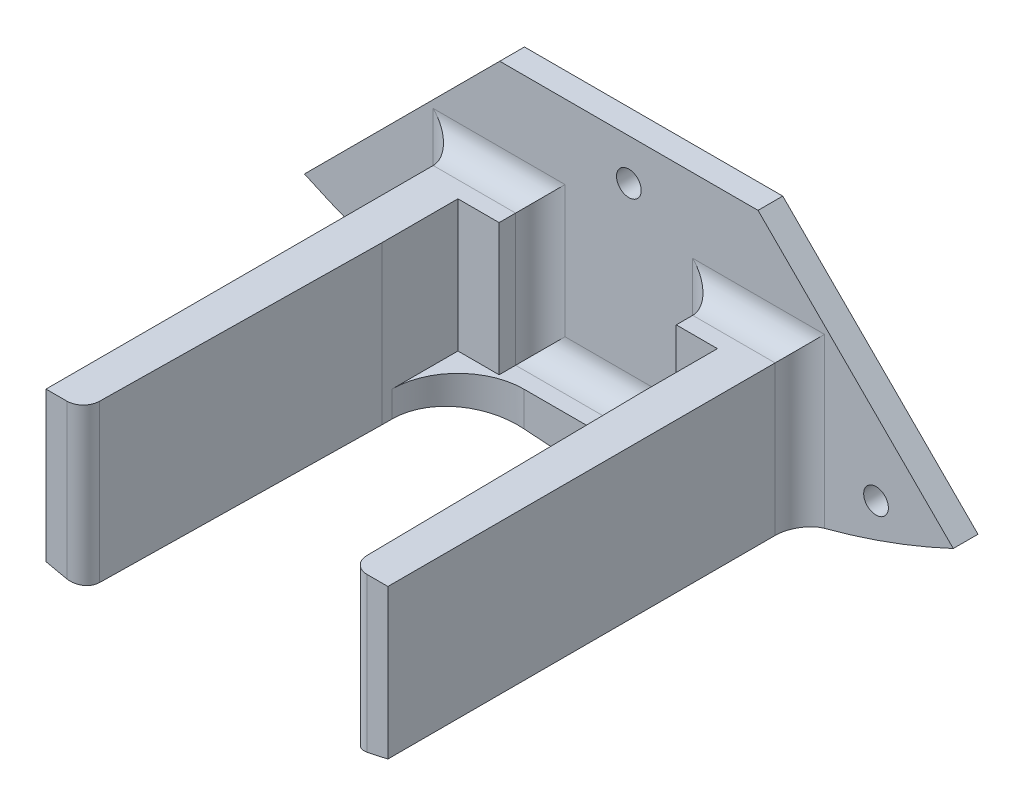
from build123d import *
from OCP.BRepFilletAPI import BRepFilletAPI_MakeChamfer

# Parameters (mm, degrees)
CROQUIS1_R                   = 1.5
SALIENTE_EXTRUIR1_DEPTH      = 3
SALIENTE_EXTRUIR2_DEPTH      = 5
SALIENTE_EXTRUIR3_REACH      = 50.975
SALIENTE_EXTRUIR3_END_RADIUS = 92.5
CROQUIS5_W                   = 5
CROQUIS5_H                   = 50
SALIENTE_EXTRUIR4_DEPTH      = 16
CHAFL_N1_SIZE                = 0.5
CHAFL_N1_SIZE2               = 35.80753506
REDONDEO1_R                  = 2
REDONDEO2_R                  = 3


with BuildPart() as part:
    # Croquis1 → Saliente-Extruir1 (new body)
    with BuildSketch(Plane.XY):
        with BuildLine():
            Line((15.676377407, -60), (-15.676377407, -60))
            Line((-15.676377407, -60), (-39.376624823, -83.700247416))
            ThreePointArc((-39.376624823, -83.700247416), (0, -92.5), (39.376624823, -83.700247416))
            Line((39.376624823, -83.700247416), (15.676377407, -60))
        make_face()
        with Locations((-30, -83.372525695)):
            Circle(CROQUIS1_R, mode=Mode.SUBTRACT)
        with Locations((30, -83.372525695)):
            Circle(CROQUIS1_R, mode=Mode.SUBTRACT)
        with Locations((0, -65)):
            Circle(CROQUIS1_R, mode=Mode.SUBTRACT)
    extrude(amount=SALIENTE_EXTRUIR1_DEPTH)

    # Croquis2 → Saliente-Extruir2 (add)
    with BuildSketch(Plane.XY.offset(3)):
        Polygon((-15.75, -80), (-15.75, -72), (-10.75, -72), (-10.75, -88), (-15.75, -88), align=None)
        Polygon((15.75, -80), (15.75, -88), (10.75, -88), (10.75, -72), (15.75, -72), align=None)
    extrude(amount=SALIENTE_EXTRUIR2_DEPTH)

    # Saliente-Extruir3: up to this cylinder (the profile starts inside it)
    saliente_extruir3_end = Plane(origin=(0, 0, 34.5), z_dir=(0, 0, -1)) * Cylinder(SALIENTE_EXTRUIR3_END_RADIUS, 287.95, mode=Mode.PRIVATE)
    # Croquis4 → Saliente-Extruir3 (add, up to the surface)
    with BuildSketch(Plane.XZ.offset(88), mode=Mode.PRIVATE) as saliente_extruir3_sk1:
        with BuildLine():
            Line((-15.75, 3), (-20.75, 3))
            Line((-20.75, 3), (-20.75, 53))
            Line((-20.75, 53), (-15.75, 53))
            Line((-15.75, 53), (-15.75, 16))
            ThreePointArc((-15.75, 16), (-13.406854249, 10.343145751), (-7.75, 8))
            Line((-7.75, 8), (7.75, 8))
            ThreePointArc((7.75, 8), (13.406854249, 10.343145751), (15.75, 16))
            Line((15.75, 16), (15.75, 53))
            Line((15.75, 53), (20.75, 53))
            Line((20.75, 53), (20.75, 3))
            Line((20.75, 3), (-15.75, 3))
        make_face()
    saliente_extruir3_tool1 = extrude(saliente_extruir3_sk1.sketch, amount=SALIENTE_EXTRUIR3_REACH, mode=Mode.PRIVATE) & saliente_extruir3_end
    add(saliente_extruir3_tool1.solids().sort_by_distance((16.399788, -88, 34.5))[0])

    # Croquis5 → Saliente-Extruir4 (add)
    with BuildSketch(Plane(origin=(0, -88, 0), x_dir=(1, 0, 0), z_dir=(0, 1, 0))):
        with Locations((-18.25, -28)):
            Rectangle(CROQUIS5_W, CROQUIS5_H)
        with Locations((18.25, -28)):
            Rectangle(CROQUIS5_W, CROQUIS5_H)
    extrude(amount=SALIENTE_EXTRUIR4_DEPTH)

    # Chaflán1: one chamfer whose edges measure the first distance from different faces: ONE call of the kernel's chamfer builder (chamfer() names one face for all edges)
    chafl_n1_edges_1 = [part.edges().sort_by_distance(p)[0] for p in [
        (-15.75, -80, 53),
    ]]
    chafl_n1_side_1 = [part.faces().sort_by_distance(p)[0] for p in [
        (-18.25, -80, 53),
    ]]
    chafl_n1_edges_2 = [part.edges().sort_by_distance(p)[0] for p in [
        (15.75, -80, 53),
    ]]
    chafl_n1_side_2 = [part.faces().sort_by_distance(p)[0] for p in [
        (18.25, -80, 53),
    ]]
    chafl_n1 = BRepFilletAPI_MakeChamfer(part.part.solid().wrapped)
    for e in chafl_n1_edges_1:
        chafl_n1.Add(CHAFL_N1_SIZE, CHAFL_N1_SIZE2, e.wrapped, chafl_n1_side_1[0].wrapped)  # the first distance lies on this face
    for e in chafl_n1_edges_2:
        chafl_n1.Add(CHAFL_N1_SIZE, CHAFL_N1_SIZE2, e.wrapped, chafl_n1_side_2[0].wrapped)  # the first distance lies on this face
    add(Compound.cast(chafl_n1.Shape()), mode=Mode.REPLACE)

    # Redondeo1
    redondeo1_edges = [part.edges().sort_by_distance(p)[0] for p in [
        (16.25, -80, 53),
        (-16.25, -80, 53),
    ]]
    fillet(redondeo1_edges, radius=REDONDEO1_R)

    # Redondeo2
    # the kernel refuses this fillet: 3 mm, written as the material it adds along each edge
    with BuildSketch(Plane(origin=(10.75, -72, 3), x_dir=(0, 1, 0), z_dir=(1, 0, 0)), Plane(origin=(-15.75, -72, 3), x_dir=(0, 1, 0), z_dir=(1, 0, 0)), Plane(origin=(-20.75, -72, 3), x_dir=(0, 1, 0), z_dir=(1, 0, 0)), Plane(origin=(15.75, -72, 3), x_dir=(0, 1, 0), z_dir=(1, 0, 0))) as redondeo2_piece_1:
        with BuildLine():
            CenterArc((REDONDEO2_R, REDONDEO2_R), REDONDEO2_R, 180, 90)
            Line((0, REDONDEO2_R), (-REDONDEO2_R * 0.02, REDONDEO2_R))
            Line((-REDONDEO2_R * 0.02, REDONDEO2_R), (-REDONDEO2_R * 0.02, -REDONDEO2_R * 0.02))
            Line((-REDONDEO2_R * 0.02, -REDONDEO2_R * 0.02), (REDONDEO2_R, -REDONDEO2_R * 0.02))
            Line((REDONDEO2_R, -REDONDEO2_R * 0.02), (REDONDEO2_R, 0))
        make_face()
    extrude(amount=5)
    with BuildSketch(Plane(origin=(10.75, -88, 3), x_dir=(-1, 0, 0), z_dir=(0, 1, 0)), Plane(origin=(-10.75, -72, 3), x_dir=(1, 0, 0), z_dir=(0, -1, 0)), Plane(origin=(-20.75, -88, 3), x_dir=(-1, 0, 0), z_dir=(0, 1, 0)), Plane(origin=(20.75, -88, 3), x_dir=(0, 0, 1), z_dir=(0, 1, 0))) as redondeo2_piece_2:
        with BuildLine():
            CenterArc((REDONDEO2_R, REDONDEO2_R), REDONDEO2_R, 180, 90)
            Line((0, REDONDEO2_R), (-REDONDEO2_R * 0.02, REDONDEO2_R))
            Line((-REDONDEO2_R * 0.02, REDONDEO2_R), (-REDONDEO2_R * 0.02, -REDONDEO2_R * 0.02))
            Line((-REDONDEO2_R * 0.02, -REDONDEO2_R * 0.02), (REDONDEO2_R, -REDONDEO2_R * 0.02))
            Line((REDONDEO2_R, -REDONDEO2_R * 0.02), (REDONDEO2_R, 0))
        make_face()
    extrude(amount=16)
    with BuildSketch(Plane(origin=(-10.75, -88, 3), x_dir=(0, 1, 0), z_dir=(1, 0, 0))) as redondeo2_piece_3:
        with BuildLine():
            CenterArc((REDONDEO2_R, REDONDEO2_R), REDONDEO2_R, 180, 90)
            Line((0, REDONDEO2_R), (-REDONDEO2_R * 0.02, REDONDEO2_R))
            Line((-REDONDEO2_R * 0.02, REDONDEO2_R), (-REDONDEO2_R * 0.02, -REDONDEO2_R * 0.02))
            Line((-REDONDEO2_R * 0.02, -REDONDEO2_R * 0.02), (REDONDEO2_R, -REDONDEO2_R * 0.02))
            Line((REDONDEO2_R, -REDONDEO2_R * 0.02), (REDONDEO2_R, 0))
        make_face()
    extrude(amount=21.5)
    with BuildSketch(Plane(origin=(20.75, -88, 3), x_dir=(0, 0, 1), z_dir=(0, -1, 0))) as redondeo2_piece_4_section:
        with BuildLine():
            CenterArc((REDONDEO2_R, -REDONDEO2_R), REDONDEO2_R, 90, 90)
            Line((0, -REDONDEO2_R), (-REDONDEO2_R * 0.02, -REDONDEO2_R))
            Line((-REDONDEO2_R * 0.02, -REDONDEO2_R), (-REDONDEO2_R * 0.02, REDONDEO2_R * 0.02))
            Line((-REDONDEO2_R * 0.02, REDONDEO2_R * 0.02), (REDONDEO2_R, REDONDEO2_R * 0.02))
            Line((REDONDEO2_R, REDONDEO2_R * 0.02), (REDONDEO2_R, 0))
        make_face()
    redondeo2_piece_4 = extrude(amount=9.64259537, mode=Mode.PRIVATE)
    redondeo2_piece_4 = redondeo2_piece_4 & Plane(origin=(0, 0, 3.709191114), x_dir=(-1, 0, 0), z_dir=(0, 0, -1)) * Cylinder(92.5, 32, mode=Mode.PRIVATE)
    add(redondeo2_piece_4)
    with BuildSketch(Plane(origin=(-20.75, -88, 3), x_dir=(0, 0, 1), z_dir=(0, -1, 0))) as redondeo2_piece_5_section:
        with BuildLine():
            CenterArc((REDONDEO2_R, REDONDEO2_R), REDONDEO2_R, 180, 90)
            Line((0, REDONDEO2_R), (-REDONDEO2_R * 0.02, REDONDEO2_R))
            Line((-REDONDEO2_R * 0.02, REDONDEO2_R), (-REDONDEO2_R * 0.02, -REDONDEO2_R * 0.02))
            Line((-REDONDEO2_R * 0.02, -REDONDEO2_R * 0.02), (REDONDEO2_R, -REDONDEO2_R * 0.02))
            Line((REDONDEO2_R, -REDONDEO2_R * 0.02), (REDONDEO2_R, 0))
        make_face()
    redondeo2_piece_5 = extrude(amount=9.64259537, mode=Mode.PRIVATE)
    redondeo2_piece_5 = redondeo2_piece_5 & Plane(origin=(0, 0, 3.709191539), x_dir=(-1, 0, 0), z_dir=(0, 0, -1)) * Cylinder(92.5, 32, mode=Mode.PRIVATE)
    add(redondeo2_piece_5)
    with BuildSketch(Plane(origin=(3.25, -72, 3), x_dir=(0, 1, 0), z_dir=(1, 0, 0))) as redondeo2_piece_6a_section:
        with BuildLine():
            CenterArc((REDONDEO2_R, REDONDEO2_R), REDONDEO2_R, 180, 90)
            Line((0, REDONDEO2_R), (-REDONDEO2_R * 0.02, REDONDEO2_R))
            Line((-REDONDEO2_R * 0.02, REDONDEO2_R), (-REDONDEO2_R * 0.02, -REDONDEO2_R * 0.02))
            Line((-REDONDEO2_R * 0.02, -REDONDEO2_R * 0.02), (REDONDEO2_R, -REDONDEO2_R * 0.02))
            Line((REDONDEO2_R, -REDONDEO2_R * 0.02), (REDONDEO2_R, 0))
        make_face()
    redondeo2_piece_6a = extrude(amount=12.5, mode=Mode.PRIVATE)
    redondeo2_piece_6a = split(redondeo2_piece_6a, bisect_by=Plane(origin=(10.75, -71.320814657, 3.679185343), z_dir=(-1, 0, 0)), keep=Keep.TOP, mode=Mode.PRIVATE)
    with BuildSketch(Plane(origin=(10.75, -88, 3), x_dir=(-1, 0, 0), z_dir=(0, 1, 0))) as redondeo2_piece_6b_section:
        with BuildLine():
            CenterArc((REDONDEO2_R, REDONDEO2_R), REDONDEO2_R, 180, 90)
            Line((0, REDONDEO2_R), (-REDONDEO2_R * 0.02, REDONDEO2_R))
            Line((-REDONDEO2_R * 0.02, REDONDEO2_R), (-REDONDEO2_R * 0.02, -REDONDEO2_R * 0.02))
            Line((-REDONDEO2_R * 0.02, -REDONDEO2_R * 0.02), (REDONDEO2_R, -REDONDEO2_R * 0.02))
            Line((REDONDEO2_R, -REDONDEO2_R * 0.02), (REDONDEO2_R, 0))
        make_face()
    redondeo2_piece_6b = extrude(amount=23.5, mode=Mode.PRIVATE)
    redondeo2_piece_6b = split(redondeo2_piece_6b, bisect_by=Plane(origin=(10.070814657, -72, 3.679185343), z_dir=(0, 1, 0)), keep=Keep.TOP, mode=Mode.PRIVATE)
    redondeo2_piece_6 = redondeo2_piece_6a & redondeo2_piece_6b
    add(redondeo2_piece_6)
    with BuildSketch(Plane(origin=(10.75, -95.5, 3), x_dir=(-1, 0, 0), z_dir=(0, 1, 0))) as redondeo2_piece_7a_section:
        with BuildLine():
            CenterArc((REDONDEO2_R, REDONDEO2_R), REDONDEO2_R, 180, 90)
            Line((0, REDONDEO2_R), (-REDONDEO2_R * 0.02, REDONDEO2_R))
            Line((-REDONDEO2_R * 0.02, REDONDEO2_R), (-REDONDEO2_R * 0.02, -REDONDEO2_R * 0.02))
            Line((-REDONDEO2_R * 0.02, -REDONDEO2_R * 0.02), (REDONDEO2_R, -REDONDEO2_R * 0.02))
            Line((REDONDEO2_R, -REDONDEO2_R * 0.02), (REDONDEO2_R, 0))
        make_face()
    redondeo2_piece_7a = extrude(amount=23.5, mode=Mode.PRIVATE)
    redondeo2_piece_7a = split(redondeo2_piece_7a, bisect_by=Plane(origin=(10.070814657, -88, 3.679185343), z_dir=(0, -1, 0)), keep=Keep.TOP, mode=Mode.PRIVATE)
    with BuildSketch(Plane(origin=(-10.75, -88, 3), x_dir=(0, 1, 0), z_dir=(1, 0, 0))) as redondeo2_piece_7b_section:
        with BuildLine():
            CenterArc((REDONDEO2_R, REDONDEO2_R), REDONDEO2_R, 180, 90)
            Line((0, REDONDEO2_R), (-REDONDEO2_R * 0.02, REDONDEO2_R))
            Line((-REDONDEO2_R * 0.02, REDONDEO2_R), (-REDONDEO2_R * 0.02, -REDONDEO2_R * 0.02))
            Line((-REDONDEO2_R * 0.02, -REDONDEO2_R * 0.02), (REDONDEO2_R, -REDONDEO2_R * 0.02))
            Line((REDONDEO2_R, -REDONDEO2_R * 0.02), (REDONDEO2_R, 0))
        make_face()
    redondeo2_piece_7b = extrude(amount=29, mode=Mode.PRIVATE)
    redondeo2_piece_7b = split(redondeo2_piece_7b, bisect_by=Plane(origin=(10.75, -87.320814657, 3.679185343), z_dir=(1, 0, 0)), keep=Keep.TOP, mode=Mode.PRIVATE)
    redondeo2_piece_7 = redondeo2_piece_7a & redondeo2_piece_7b
    add(redondeo2_piece_7)
    with BuildSketch(Plane(origin=(-10.75, -64.5, 3), x_dir=(1, 0, 0), z_dir=(0, -1, 0))) as redondeo2_piece_8a_section:
        with BuildLine():
            CenterArc((REDONDEO2_R, REDONDEO2_R), REDONDEO2_R, 180, 90)
            Line((0, REDONDEO2_R), (-REDONDEO2_R * 0.02, REDONDEO2_R))
            Line((-REDONDEO2_R * 0.02, REDONDEO2_R), (-REDONDEO2_R * 0.02, -REDONDEO2_R * 0.02))
            Line((-REDONDEO2_R * 0.02, -REDONDEO2_R * 0.02), (REDONDEO2_R, -REDONDEO2_R * 0.02))
            Line((REDONDEO2_R, -REDONDEO2_R * 0.02), (REDONDEO2_R, 0))
        make_face()
    redondeo2_piece_8a = extrude(amount=23.5, mode=Mode.PRIVATE)
    redondeo2_piece_8a = split(redondeo2_piece_8a, bisect_by=Plane(origin=(-10.070814657, -72, 3.679185343), z_dir=(0, 1, 0)), keep=Keep.TOP, mode=Mode.PRIVATE)
    with BuildSketch(Plane(origin=(-15.75, -72, 3), x_dir=(0, 1, 0), z_dir=(1, 0, 0))) as redondeo2_piece_8b_section:
        with BuildLine():
            CenterArc((REDONDEO2_R, REDONDEO2_R), REDONDEO2_R, 180, 90)
            Line((0, REDONDEO2_R), (-REDONDEO2_R * 0.02, REDONDEO2_R))
            Line((-REDONDEO2_R * 0.02, REDONDEO2_R), (-REDONDEO2_R * 0.02, -REDONDEO2_R * 0.02))
            Line((-REDONDEO2_R * 0.02, -REDONDEO2_R * 0.02), (REDONDEO2_R, -REDONDEO2_R * 0.02))
            Line((REDONDEO2_R, -REDONDEO2_R * 0.02), (REDONDEO2_R, 0))
        make_face()
    redondeo2_piece_8b = extrude(amount=12.5, mode=Mode.PRIVATE)
    redondeo2_piece_8b = split(redondeo2_piece_8b, bisect_by=Plane(origin=(-10.75, -71.320814657, 3.679185343), z_dir=(1, 0, 0)), keep=Keep.TOP, mode=Mode.PRIVATE)
    redondeo2_piece_8 = redondeo2_piece_8a & redondeo2_piece_8b
    add(redondeo2_piece_8)
    with BuildSketch(Plane(origin=(-18.25, -88, 3), x_dir=(0, 1, 0), z_dir=(1, 0, 0))) as redondeo2_piece_9a_section:
        with BuildLine():
            CenterArc((REDONDEO2_R, REDONDEO2_R), REDONDEO2_R, 180, 90)
            Line((0, REDONDEO2_R), (-REDONDEO2_R * 0.02, REDONDEO2_R))
            Line((-REDONDEO2_R * 0.02, REDONDEO2_R), (-REDONDEO2_R * 0.02, -REDONDEO2_R * 0.02))
            Line((-REDONDEO2_R * 0.02, -REDONDEO2_R * 0.02), (REDONDEO2_R, -REDONDEO2_R * 0.02))
            Line((REDONDEO2_R, -REDONDEO2_R * 0.02), (REDONDEO2_R, 0))
        make_face()
    redondeo2_piece_9a = extrude(amount=29, mode=Mode.PRIVATE)
    redondeo2_piece_9a = split(redondeo2_piece_9a, bisect_by=Plane(origin=(-10.75, -87.320814657, 3.679185343), z_dir=(-1, 0, 0)), keep=Keep.TOP, mode=Mode.PRIVATE)
    with BuildSketch(Plane(origin=(-10.75, -72, 3), x_dir=(1, 0, 0), z_dir=(0, -1, 0))) as redondeo2_piece_9b_section:
        with BuildLine():
            CenterArc((REDONDEO2_R, REDONDEO2_R), REDONDEO2_R, 180, 90)
            Line((0, REDONDEO2_R), (-REDONDEO2_R * 0.02, REDONDEO2_R))
            Line((-REDONDEO2_R * 0.02, REDONDEO2_R), (-REDONDEO2_R * 0.02, -REDONDEO2_R * 0.02))
            Line((-REDONDEO2_R * 0.02, -REDONDEO2_R * 0.02), (REDONDEO2_R, -REDONDEO2_R * 0.02))
            Line((REDONDEO2_R, -REDONDEO2_R * 0.02), (REDONDEO2_R, 0))
        make_face()
    redondeo2_piece_9b = extrude(amount=23.5, mode=Mode.PRIVATE)
    redondeo2_piece_9b = split(redondeo2_piece_9b, bisect_by=Plane(origin=(-10.070814657, -88, 3.679185343), z_dir=(0, -1, 0)), keep=Keep.TOP, mode=Mode.PRIVATE)
    redondeo2_piece_9 = redondeo2_piece_9a & redondeo2_piece_9b
    add(redondeo2_piece_9)
    with BuildSketch(Plane(origin=(-28.25, -72, 3), x_dir=(0, 1, 0), z_dir=(1, 0, 0))) as redondeo2_piece_10a_section:
        with BuildLine():
            CenterArc((REDONDEO2_R, REDONDEO2_R), REDONDEO2_R, 180, 90)
            Line((0, REDONDEO2_R), (-REDONDEO2_R * 0.02, REDONDEO2_R))
            Line((-REDONDEO2_R * 0.02, REDONDEO2_R), (-REDONDEO2_R * 0.02, -REDONDEO2_R * 0.02))
            Line((-REDONDEO2_R * 0.02, -REDONDEO2_R * 0.02), (REDONDEO2_R, -REDONDEO2_R * 0.02))
            Line((REDONDEO2_R, -REDONDEO2_R * 0.02), (REDONDEO2_R, 0))
        make_face()
    redondeo2_piece_10a = extrude(amount=12.5, mode=Mode.PRIVATE)
    redondeo2_piece_10a = split(redondeo2_piece_10a, bisect_by=Plane(origin=(-25.485611377, -69.809233969, 3.718740777), z_dir=(0.707106781186549, -0.7071067811865461, 0)), keep=Keep.TOP, mode=Mode.PRIVATE)
    redondeo2_piece_10a = split(redondeo2_piece_10a, bisect_by=Plane(origin=(-20.75, -71.387771095, 3.718740777), z_dir=(-1, 0, 0)), keep=Keep.TOP, mode=Mode.PRIVATE)
    with BuildSketch(Plane(origin=(-20.75, -88, 3), x_dir=(-1, 0, 0), z_dir=(0, 1, 0))) as redondeo2_piece_10b_section:
        with BuildLine():
            CenterArc((REDONDEO2_R, REDONDEO2_R), REDONDEO2_R, 180, 90)
            Line((0, REDONDEO2_R), (-REDONDEO2_R * 0.02, REDONDEO2_R))
            Line((-REDONDEO2_R * 0.02, REDONDEO2_R), (-REDONDEO2_R * 0.02, -REDONDEO2_R * 0.02))
            Line((-REDONDEO2_R * 0.02, -REDONDEO2_R * 0.02), (REDONDEO2_R, -REDONDEO2_R * 0.02))
            Line((REDONDEO2_R, -REDONDEO2_R * 0.02), (REDONDEO2_R, 0))
        make_face()
    redondeo2_piece_10b = extrude(amount=23.5, mode=Mode.PRIVATE)
    redondeo2_piece_10b = split(redondeo2_piece_10b, bisect_by=Plane(origin=(-22.940766031, -67.264388623, 3.718740777), z_dir=(0.707106781186549, -0.7071067811865461, 0)), keep=Keep.TOP, mode=Mode.PRIVATE)
    redondeo2_piece_10b = split(redondeo2_piece_10b, bisect_by=Plane(origin=(-21.362228905, -72, 3.718740777), z_dir=(0, 1, 0)), keep=Keep.TOP, mode=Mode.PRIVATE)
    redondeo2_piece_10 = redondeo2_piece_10a & redondeo2_piece_10b
    add(redondeo2_piece_10)
    with BuildSketch(Plane(origin=(20.75, -88, 3), x_dir=(0, 0, 1), z_dir=(0, 1, 0))) as redondeo2_piece_11a_section:
        with BuildLine():
            CenterArc((REDONDEO2_R, REDONDEO2_R), REDONDEO2_R, 180, 90)
            Line((0, REDONDEO2_R), (-REDONDEO2_R * 0.02, REDONDEO2_R))
            Line((-REDONDEO2_R * 0.02, REDONDEO2_R), (-REDONDEO2_R * 0.02, -REDONDEO2_R * 0.02))
            Line((-REDONDEO2_R * 0.02, -REDONDEO2_R * 0.02), (REDONDEO2_R, -REDONDEO2_R * 0.02))
            Line((REDONDEO2_R, -REDONDEO2_R * 0.02), (REDONDEO2_R, 0))
        make_face()
    redondeo2_piece_11a = extrude(amount=23.5, mode=Mode.PRIVATE)
    redondeo2_piece_11a = split(redondeo2_piece_11a, bisect_by=Plane(origin=(21.362228905, -72, 3.718740777), z_dir=(0, 1, 0)), keep=Keep.TOP, mode=Mode.PRIVATE)
    redondeo2_piece_11a = split(redondeo2_piece_11a, bisect_by=Plane(origin=(22.940766031, -67.264388623, 3.718740777), z_dir=(-0.7071067811865434, -0.7071067811865517, 0)), keep=Keep.TOP, mode=Mode.PRIVATE)
    with BuildSketch(Plane(origin=(15.75, -72, 3), x_dir=(0, 1, 0), z_dir=(1, 0, 0))) as redondeo2_piece_11b_section:
        with BuildLine():
            CenterArc((REDONDEO2_R, REDONDEO2_R), REDONDEO2_R, 180, 90)
            Line((0, REDONDEO2_R), (-REDONDEO2_R * 0.02, REDONDEO2_R))
            Line((-REDONDEO2_R * 0.02, REDONDEO2_R), (-REDONDEO2_R * 0.02, -REDONDEO2_R * 0.02))
            Line((-REDONDEO2_R * 0.02, -REDONDEO2_R * 0.02), (REDONDEO2_R, -REDONDEO2_R * 0.02))
            Line((REDONDEO2_R, -REDONDEO2_R * 0.02), (REDONDEO2_R, 0))
        make_face()
    redondeo2_piece_11b = extrude(amount=12.5, mode=Mode.PRIVATE)
    redondeo2_piece_11b = split(redondeo2_piece_11b, bisect_by=Plane(origin=(20.75, -71.387771095, 3.718740777), z_dir=(1, 0, 0)), keep=Keep.TOP, mode=Mode.PRIVATE)
    redondeo2_piece_11b = split(redondeo2_piece_11b, bisect_by=Plane(origin=(25.485611377, -69.809233969, 3.718740777), z_dir=(-0.7071067811865434, -0.7071067811865517, 0)), keep=Keep.TOP, mode=Mode.PRIVATE)
    redondeo2_piece_11 = redondeo2_piece_11a & redondeo2_piece_11b
    add(redondeo2_piece_11)


solid = part.part
